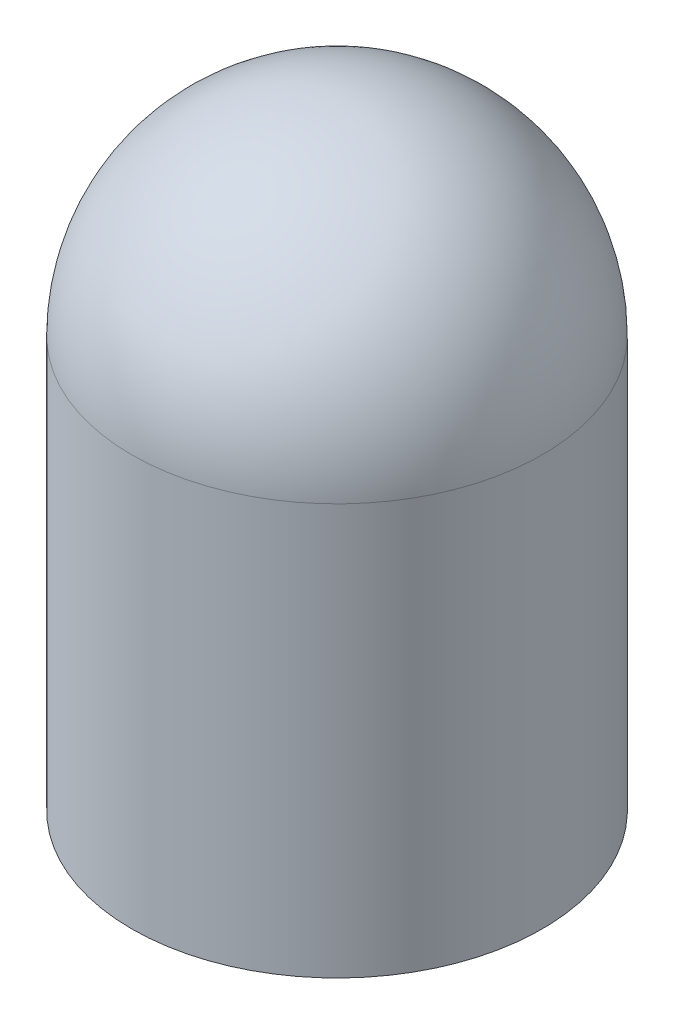
from build123d import *

# Parameters (mm, degrees)
SKETCH1_R           = 40
SKETCH1_R_2         = 36
BOSS_EXTRUDE1_DEPTH = 80


# Read off the part's stored shape, not the designer's step: Revolve1
with BuildPart() as part:
    # Sketch1 → Boss-Extrude1 (new body)
    with BuildSketch(Plane(origin=(0, 0, 0), x_dir=(1, 0, 0), z_dir=(0, 1, 0))):
        with Locations(Location((0, 0, 0), (0, 0, 270))):
            Circle(SKETCH1_R)
        with Locations(Location((0, 0, 0), (0, 0, 270))):
            Circle(SKETCH1_R_2, mode=Mode.SUBTRACT)
    extrude(amount=BOSS_EXTRUDE1_DEPTH)

    # Revolve1 outline → Revolve1 (revolve)
    with BuildSketch(Plane.XY):
        with BuildLine():
            ThreePointArc((0, 116), (25.455844135, 105.45584411), (36, 79.999999964))
            Line((36, 79.999999964), (40, 79.99999997))
            ThreePointArc((40, 79.99999997), (28.284271258, 108.284271237), (0, 120))
            Line((0, 120), (0, 116))
        make_face()
    revolve(axis=Axis((0, 0, 0), (0, 1, 0)))


solid = part.part
